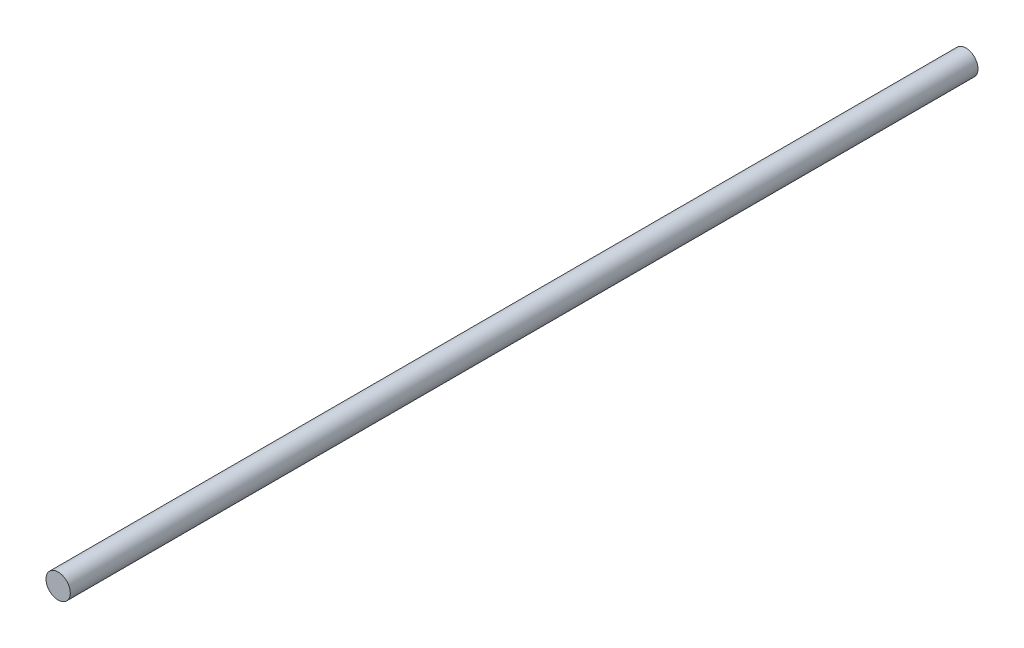
from build123d import *

# Parameters (mm, degrees)
SKETCH1_R           = 2.38125
BOSS_EXTRUDE1_DEPTH = 88.9


with BuildPart() as part:
    # Sketch1 → Boss-Extrude1 (new, symmetric)
    with BuildSketch(Plane.XY):
        Circle(SKETCH1_R)
    extrude(amount=BOSS_EXTRUDE1_DEPTH, both=True)


solid = part.part
